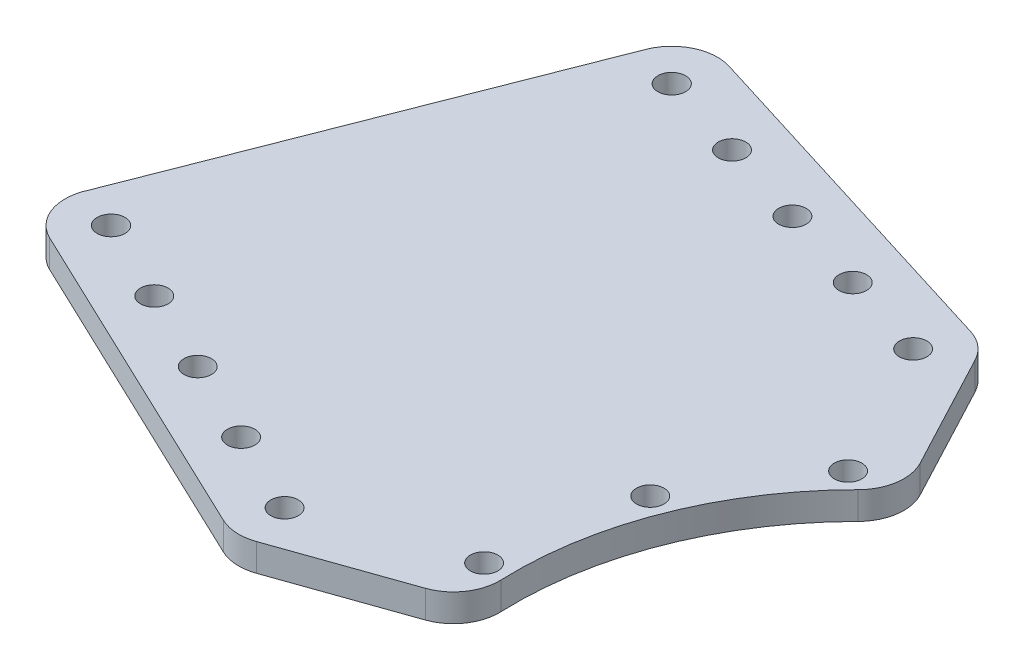
from build123d import *

# Parameters (mm, degrees)
SKETCH_2_R      = 1.5
SKETCH_2_R_2    = 1.518721219
SKETCH_2_R_3    = 1.512738874
EXTRUDE_1_DEPTH = 3


with BuildPart() as part:
    # 草图2 → 凸台-拉伸1 (new body)
    with BuildSketch(Plane(origin=(0, -17.395889641, 0), x_dir=(1, 0, 0), z_dir=(0, 1, 0))):
        with BuildLine():
            Line((-67.750211529, -36.977031927), (-103.858972682, -19.797438789))
            ThreePointArc((-103.858972682, -19.797438789), (-106.429442956, -16.948260564), (-106.232366674, -13.115990359))
            Line((-106.232366674, -13.115990359), (-89.185537995, 30.475859314))
            ThreePointArc((-89.185537995, 30.475859314), (-86.69601178, 33.160837283), (-83.04433662, 33.429381478))
            Line((-83.04433662, 33.429381478), (-44.860392292, 21.55641016))
            ThreePointArc((-44.860392292, 21.55641016), (-43.151818029, 20.629450998), (-41.925856607, 19.120975645))
            Line((-41.925856607, 19.120975645), (-35.176480428, 6.369645252))
            ThreePointArc((-35.176480428, 6.369645252), (-34.651006031, 3.288347657), (-36.057985487, 0.497124446))
            ThreePointArc((-36.057985487, 0.497124446), (-44.450352857, -12.346252855), (-46.996898287, -27.475670456))
            ThreePointArc((-46.996898287, -27.475670456), (-47.856649261, -30.480890326), (-50.332989366, -32.388312117))
            Line((-50.332989366, -32.388312117), (-63.942022797, -37.178376279))
            ThreePointArc((-63.942022797, -37.178376279), (-65.866066657, -37.455025022), (-67.750211529, -36.977031927))
        make_face()
        with Locations((-65.602078267, -32.461998872)):
            Circle(SKETCH_2_R, mode=Mode.SUBTRACT)
        with Locations((-74.632144377, -28.165732348)):
            Circle(SKETCH_2_R, mode=Mode.SUBTRACT)
        with Locations((-83.662210487, -23.869465823)):
            Circle(SKETCH_2_R, mode=Mode.SUBTRACT)
        with Locations((-92.692276597, -19.573199299)):
            Circle(SKETCH_2_R, mode=Mode.SUBTRACT)
        with Locations((-101.704945463, -15.270017578)):
            Circle(SKETCH_2_R_2, mode=Mode.SUBTRACT)
        with Locations((-84.528930836, 28.654867889)):
            Circle(SKETCH_2_R_3, mode=Mode.SUBTRACT)
        with Locations((-74.992068043, 25.689461869)):
            Circle(SKETCH_2_R, mode=Mode.SUBTRACT)
        with Locations((-65.443040865, 22.720273436)):
            Circle(SKETCH_2_R, mode=Mode.SUBTRACT)
        with Locations((-55.894013686, 19.751085004)):
            Circle(SKETCH_2_R, mode=Mode.SUBTRACT)
        with Locations((-46.344986508, 16.781896571)):
            Circle(SKETCH_2_R, mode=Mode.SUBTRACT)
        with Locations((-38.368045535, 1.711376394)):
            Circle(SKETCH_2_R, mode=Mode.SUBTRACT)
        with Locations((-46.778656436, -11.435757143)):
            Circle(SKETCH_2_R, mode=Mode.SUBTRACT)
        with Locations((-49.517857516, -26.800726176)):
            Circle(SKETCH_2_R, mode=Mode.SUBTRACT)
    extrude(amount=EXTRUDE_1_DEPTH)


solid = part.part
